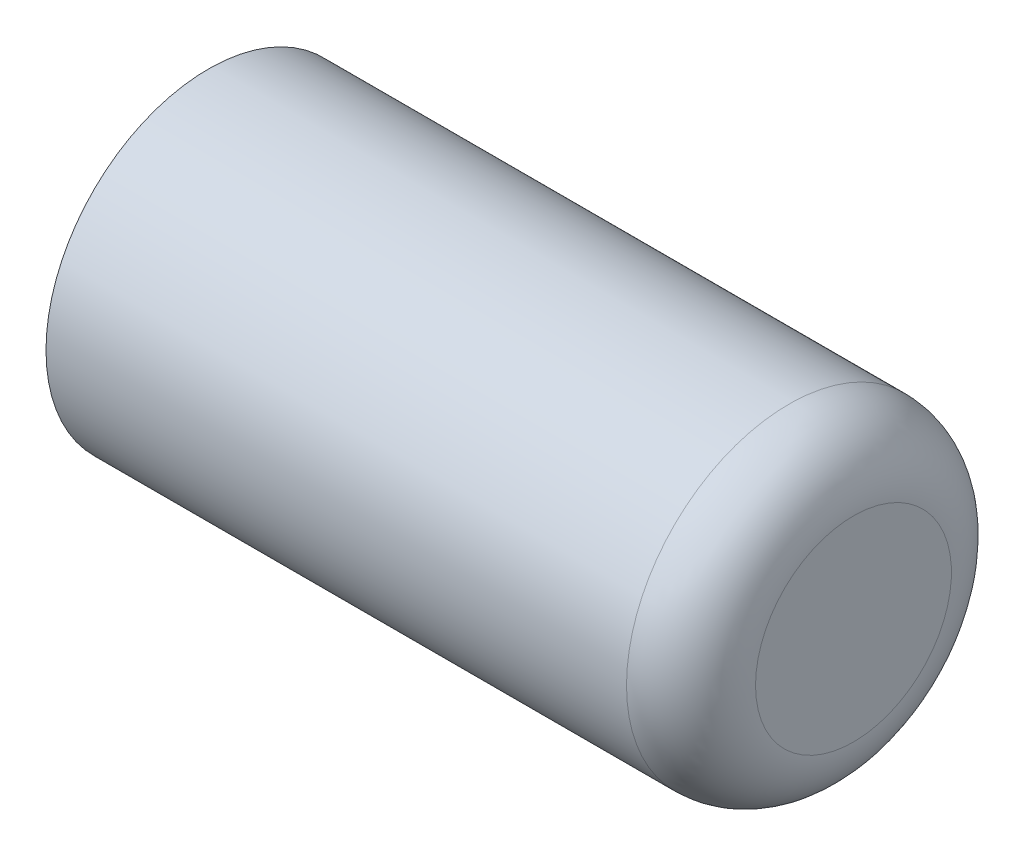
from build123d import *

# Parameters (mm, degrees)
SKETCH4_R           = 63.976773009
SKETCH4_R_2         = 38.1
BOSS_EXTRUDE1_DEPTH = 254
BOSS_EXTRUDE2_START = -50.8
SKETCH5_R           = 63.976773009
BOSS_EXTRUDE2_DEPTH = 50.8
FILLET2_R           = 25.4


with BuildPart() as part:
    # Sketch4 → Boss-Extrude1 (new body)
    with BuildSketch(Plane.ZY.offset(127)):
        Circle(SKETCH4_R)
        Circle(SKETCH4_R_2, mode=Mode.SUBTRACT)
    extrude(amount=-BOSS_EXTRUDE1_DEPTH)

    # Sketch5 → Boss-Extrude2 (add)
    with BuildSketch(Plane(origin=(127, 0, 0), x_dir=(0, 0, -1), z_dir=(1, 0, 0)).offset(BOSS_EXTRUDE2_START)):
        Circle(SKETCH5_R)
    extrude(amount=BOSS_EXTRUDE2_DEPTH)

    # Fillet2
    fillet2_edges = [part.edges().sort_by_distance(p)[0] for p in [
        (127, 0, -63.976773009),
    ]]
    fillet(fillet2_edges, radius=FILLET2_R)


solid = part.part
